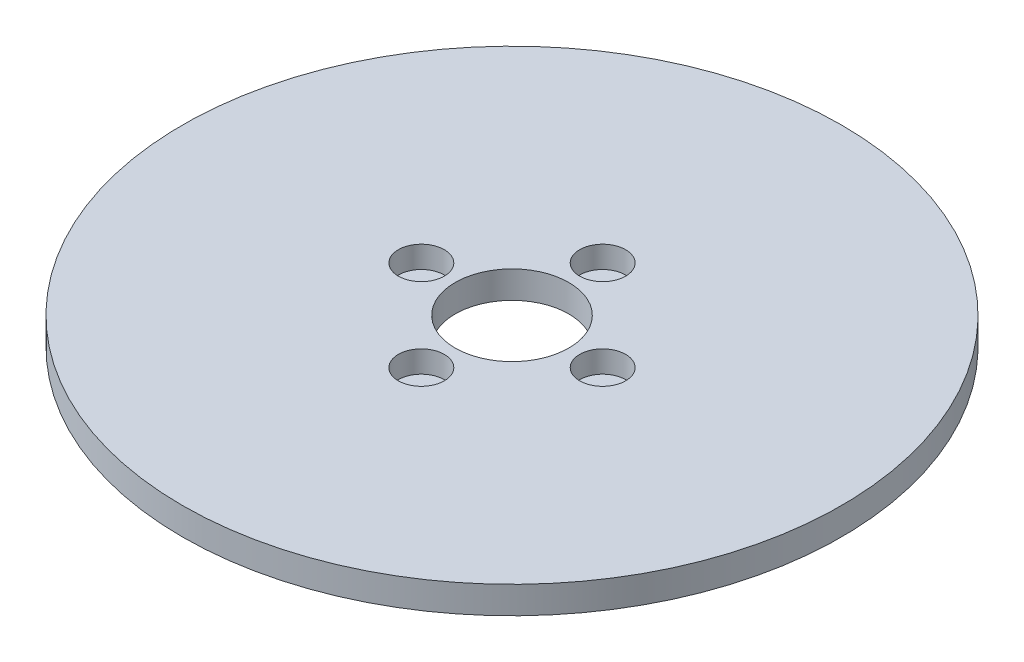
from build123d import *

# Parameters (mm, degrees)
SKETCH1_R           = 72.5
BOSS_EXTRUDE1_DEPTH = 6
SKETCH2_R           = 12.5
CUT_EXTRUDE1_DEPTH  = 103.705890776
SKETCH3_R           = 5.053032706
CUT_EXTRUDE2_DEPTH  = 4.826902556
CIRPATTERN1_COUNT   = 4


with BuildPart() as part:
    # Sketch1 → Boss-Extrude1 (new body)
    with BuildSketch(Plane(origin=(0, 0, 0), x_dir=(1, 0, 0), z_dir=(0, 1, 0))):
        Circle(SKETCH1_R)
    extrude(amount=BOSS_EXTRUDE1_DEPTH)

    # Sketch2 → Cut-Extrude1 (cut, through all)
    with BuildSketch(Plane(origin=(0, 0, 0), x_dir=(1, 0, 0), z_dir=(0, 1, 0))):
        Circle(SKETCH2_R)
    extrude(amount=CUT_EXTRUDE1_DEPTH, mode=Mode.SUBTRACT)

    # Sketch3 → Cut-Extrude2 (cut)
    with BuildSketch(Plane(origin=(0, 6, 0), x_dir=(1, 0, 0), z_dir=(0, 1, 0))):
        with Locations((-19.943598469, 0)):
            Circle(SKETCH3_R)
    cut_extrude2 = extrude(amount=-CUT_EXTRUDE2_DEPTH, mode=Mode.SUBTRACT)

    # CirPattern1: Cut-Extrude2 ×4 about axis
    cirpattern1_axis = Axis((0, 0, 0), (0, 1, 0))
    for i in range(1, CIRPATTERN1_COUNT):
        add(cut_extrude2.rotate(cirpattern1_axis, i * 360 / CIRPATTERN1_COUNT), mode=Mode.SUBTRACT)


solid = part.part
